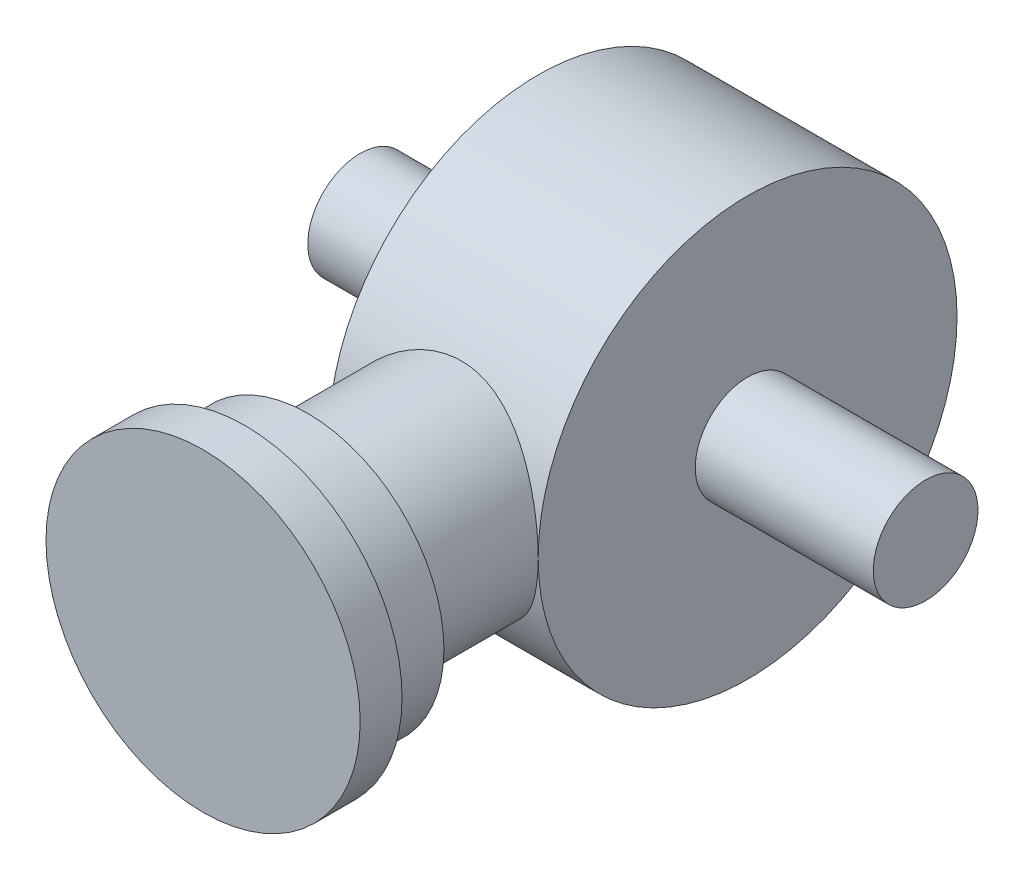
from build123d import *

# Parameters (mm, degrees)
CROQUIS1_R                   = 25.4
SALIENTE_EXTRUIR1_DEPTH      = 12.7
SALIENTE_EXTRUIR2_REACH      = 73.887
SALIENTE_EXTRUIR2_END_RADIUS = 25.4
CROQUIS2_R                   = 12.7
CROQUIS3_R                   = 16.51
SALIENTE_EXTRUIR3_DEPTH      = 7.62
CROQUIS4_R                   = 19.05
SALIENTE_EXTRUIR4_DEPTH      = 5.08
CROQUIS6_R                   = 6.35
SALIENTE_EXTRUIR5_DEPTH      = 34.29


with BuildPart() as part:
    # Croquis1 → Saliente-Extruir1 (new, symmetric)
    with BuildSketch(Plane(origin=(0, 0, 0), x_dir=(0, 0, -1), z_dir=(1, 0, 0))):
        Circle(CROQUIS1_R)
    extrude(amount=SALIENTE_EXTRUIR1_DEPTH, both=True)

    # Saliente-Extruir2: up to this cylinder (the profile starts outside it)
    saliente_extruir2_end = Plane(origin=(0, 0, 0), z_dir=(-1, 0, 0)) * Cylinder(SALIENTE_EXTRUIR2_END_RADIUS, 199.574, mode=Mode.PRIVATE)
    # Croquis2 → Saliente-Extruir2 (add, up to the surface)
    with BuildSketch(Plane.XY.offset(40.64), mode=Mode.PRIVATE) as saliente_extruir2_sk1:
        Circle(CROQUIS2_R)
    saliente_extruir2_tool1 = extrude(saliente_extruir2_sk1.sketch, amount=-SALIENTE_EXTRUIR2_REACH, mode=Mode.PRIVATE) - saliente_extruir2_end
    add(saliente_extruir2_tool1.solids().sort_by_distance((0, 0, 40.64))[0])

    # Croquis3 → Saliente-Extruir3 (add)
    with BuildSketch(Plane.XY.offset(40.64)):
        Circle(CROQUIS3_R)
    extrude(amount=SALIENTE_EXTRUIR3_DEPTH)

    # Croquis4 → Saliente-Extruir4 (add)
    with BuildSketch(Plane.XY.offset(48.26)):
        Circle(CROQUIS4_R)
    extrude(amount=SALIENTE_EXTRUIR4_DEPTH)

    # Croquis6 → Saliente-Extruir5 (add, symmetric)
    with BuildSketch(Plane(origin=(0, 0, 0), x_dir=(0, 0, -1), z_dir=(1, 0, 0))):
        Circle(CROQUIS6_R)
    extrude(amount=SALIENTE_EXTRUIR5_DEPTH, both=True)


solid = part.part
